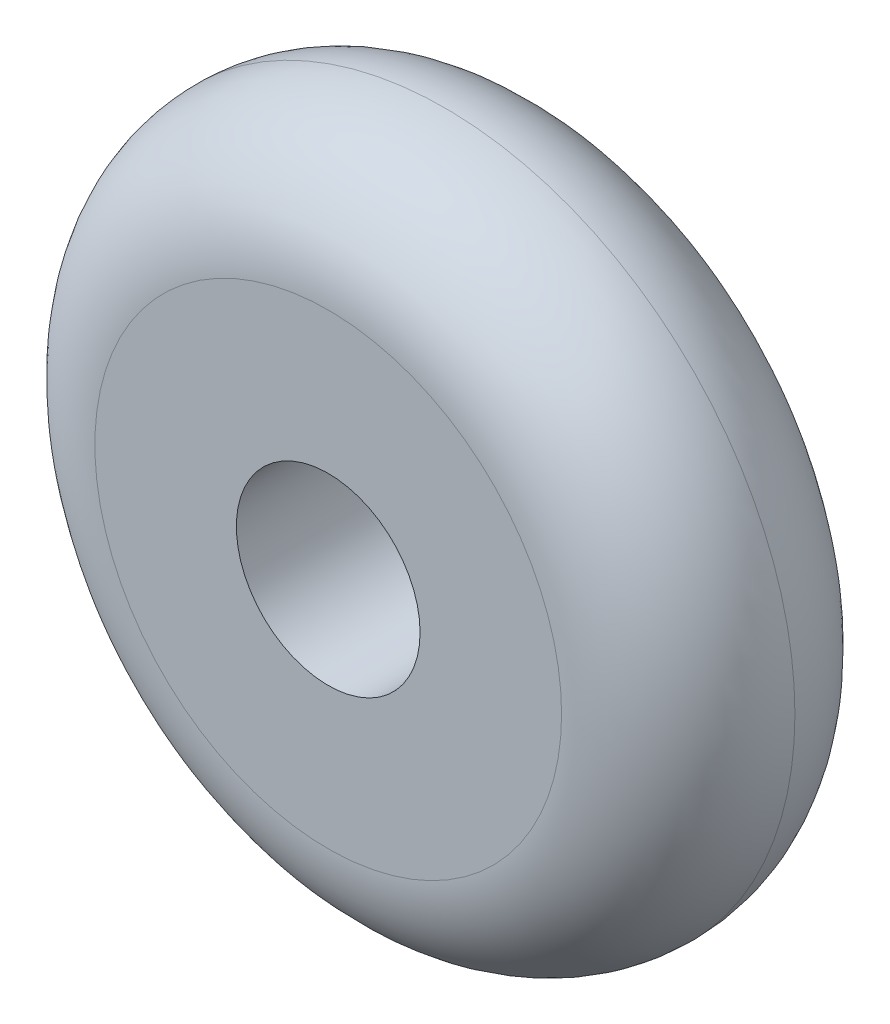
from build123d import *

# Parameters (mm, degrees)
SKETCH1_R               = 38.1
BOSS_EXTRUDE1_DEPTH     = 12.7
FILLET1_R               = 12.7
CUT_EXTRUDE1_DEPTH      = 60.56828015
CUT_EXTRUDE1_DEPTH_BACK = 60.56828015
SKETCH2_R               = 9.999999939


with BuildPart() as part:
    # Sketch1 → Boss-Extrude1 (new, symmetric)
    with BuildSketch(Plane.XY):
        Circle(SKETCH1_R)
    extrude(amount=BOSS_EXTRUDE1_DEPTH, both=True)

    # Fillet1
    fillet1_edges = [part.edges().sort_by_distance(p)[0] for p in [
        (-38.1, 0, -12.7),
        (-38.1, 0, 12.7),
    ]]
    fillet(fillet1_edges, radius=FILLET1_R - 0.0001)  # a hair under: the kernel refuses the full size

    # Sketch2 → Cut-Extrude1 (cut, two sides: drawn at the far end of the back side and taken through both)
    with BuildSketch(Plane.XY.offset(12.7).offset(-CUT_EXTRUDE1_DEPTH_BACK)):
        Circle(SKETCH2_R)
    extrude(amount=CUT_EXTRUDE1_DEPTH + CUT_EXTRUDE1_DEPTH_BACK, mode=Mode.SUBTRACT)


solid = part.part
